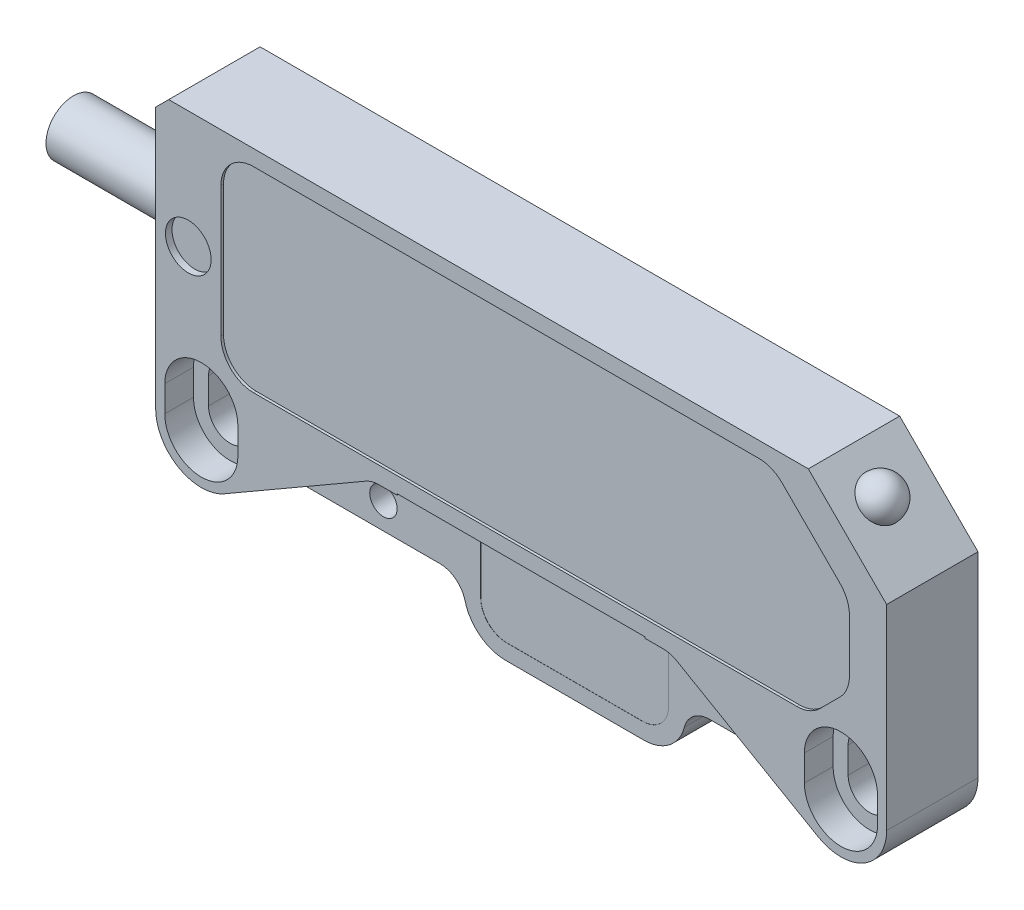
from build123d import *

# Parameters (mm, degrees)
BOSS_EXTRUDE1_DEPTH  = 7
CUT_EXTRUDE1_DEPTH   = 0.2
FILLET1_R            = 2.5
CHAMFER1_SIZE        = 6
CUT_EXTRUDE4_DEPTH   = 2.2
CUT_EXTRUDE5_DEPTH   = 59.720013624
SKETCH14_R           = 2.2
CUT_EXTRUDE9_DEPTH   = 0.2
CUT_EXTRUDE10_DEPTH  = 4.11
CHAMFER3_SIZE        = 1
FILLET3_R            = 3.2
SKETCH29_R           = 1.05
CUT_EXTRUDE16_DEPTH  = 10
FILLET5_R            = 2
FILLET6_R            = 2
MIRROR2_COPY_1_DEPTH = 2.2
SKETCH31_R           = 1.75
CUT_EXTRUDE17_DEPTH  = 0.5
CUT_EXTRUDE19_START  = -4.1
CUT_EXTRUDE19_DEPTH  = 4.1
SKETCH33_R           = 2.1
BOSS_EXTRUDE2_DEPTH  = 10


with BuildPart() as part:
    # Sketch1 → Boss-Extrude1 (new body)
    with BuildSketch(Plane.XY):
        with BuildLine():
            Line((0, -4), (0, 17))
            Line((0, 17), (56, 17))
            Line((56, 17), (56, -4))
            ThreePointArc((56, -4), (54.974873734, -6.474873734), (52.5, -7.5))
            Line((52.5, -7.5), (36.5, -7.5))
            Line((36.5, -7.5), (36.5, -11.4))
            Line((36.5, -11.4), (19.5, -11.4))
            Line((19.5, -11.4), (19.5, -7.5))
            Line((19.5, -7.5), (3.5, -7.5))
            ThreePointArc((3.5, -7.5), (1.025126266, -6.474873734), (0, -4))
        make_face()
    extrude(amount=BOSS_EXTRUDE1_DEPTH)

    # Sketch2 → Cut-Extrude1 (cut)
    with BuildSketch(Plane.XY.offset(7)):
        Polygon((5, 15.8), (5, 0.8), (50.15, 0.8), (53.15, 3.8), (53.15, 9.9), (47.25, 15.8), align=None)
    extrude(amount=-CUT_EXTRUDE1_DEPTH, mode=Mode.SUBTRACT)

    # Fillet1
    fillet1_edges = [part.edges().sort_by_distance(p)[0] for p in [
        (47.25, 15.8, 6.9),
        (53.15, 9.9, 6.9),
        (53.15, 3.8, 6.9),
        (50.15, 0.8, 6.9),
        (5, 0.8, 6.9),
        (5, 15.8, 6.9),
    ]]
    fillet(fillet1_edges, radius=FILLET1_R)

    # Chamfer1
    chamfer1_edges = [part.edges().sort_by_distance(p)[0] for p in [
        (56, 17, 3.5),
    ]]
    chamfer(chamfer1_edges, length=CHAMFER1_SIZE)

    # Sketch6 → Cut-Extrude4 (cut)
    with BuildSketch(Plane.XY.offset(7)):
        with BuildLine():
            Line((49.7, -4), (49.7, -2))
            ThreePointArc((49.7, -2), (52.5, 0.8), (55.3, -2))
            Line((55.3, -2), (55.3, -4))
            ThreePointArc((55.3, -4), (52.5, -6.8), (49.7, -4))
        make_face()
    cut_extrude4 = extrude(amount=-CUT_EXTRUDE4_DEPTH, mode=Mode.SUBTRACT)

    # Sketch9 → Cut-Extrude5 (cut, through all)
    with BuildSketch(Plane.XY.offset(4.8)):
        with BuildLine():
            Line((54.15, -4), (54.15, -2))
            ThreePointArc((54.15, -2), (52.5, -0.35), (50.85, -2))
            Line((50.85, -2), (50.85, -4))
            ThreePointArc((50.85, -4), (52.5, -5.65), (54.15, -4))
        make_face()
    cut_extrude5 = extrude(amount=-CUT_EXTRUDE5_DEPTH, mode=Mode.SUBTRACT)

    # Mirror1: Cut-Extrude4 across plane
    add(cut_extrude4.mirror(Plane.XY.offset(3.5)), mode=Mode.SUBTRACT)

    # Sketch14 → Cut-Extrude9 (cut)
    with BuildSketch(Plane(origin=(0, 24, 0), x_dir=(0, -1, 0), z_dir=(1, 0, 0))):
        with Locations(Location((16, -3.5, 0), (0, 0, 90))):
            Circle(SKETCH14_R)
    extrude(amount=CUT_EXTRUDE9_DEPTH, mode=Mode.SUBTRACT)

    # Sketch19 → Cut-Extrude10 (cut)
    with BuildSketch(Plane.XY.offset(7)):
        with BuildLine():
            Line((20.8, -0.4), (35.2, -0.4))
            Line((35.2, -0.4), (35.2, -8.2))
            ThreePointArc((35.2, -8.2), (34.614213562, -9.614213562), (33.2, -10.2))
            Line((33.2, -10.2), (22.8, -10.2))
            ThreePointArc((22.8, -10.2), (21.385786438, -9.614213562), (20.8, -8.2))
            Line((20.8, -8.2), (20.8, -0.4))
        make_face()
    extrude(amount=-CUT_EXTRUDE10_DEPTH, mode=Mode.SUBTRACT)

    # Chamfer3
    chamfer3_edges = [part.edges().sort_by_distance(p)[0] for p in [
        (0, 17, 3.5),
    ]]
    chamfer(chamfer3_edges, length=CHAMFER3_SIZE)

    # Fillet3
    fillet3_edges = [part.edges().sort_by_distance(p)[0] for p in [
        (36.5, -11.4, 3.5),
        (19.5, -11.4, 3.5),
    ]]
    fillet(fillet3_edges, radius=FILLET3_R)

    # Sketch29 → Cut-Extrude16 (cut)
    with BuildSketch(Plane(origin=(0, 0, 0), x_dir=(-1, 0, 0), z_dir=(0, 0, -1))):
        with Locations((-42.65, -5.5)):
            Circle(SKETCH29_R)
        with Locations((-41, -2.7)):
            Circle(SKETCH29_R)
        with Locations((-13.35, -5.5)):
            Circle(SKETCH29_R)
        with Locations((-15, -2.7)):
            Circle(SKETCH29_R)
    extrude(amount=-CUT_EXTRUDE16_DEPTH, mode=Mode.SUBTRACT)

    # Fillet5
    # the kernel refuses this fillet: 2 mm, written as the material it adds along each edge
    with BuildSketch(Plane(origin=(19.5, -7.5, 0), x_dir=(0.06758731351152399, -0.9977133631721562, 0), z_dir=(0, 0, 1))) as fillet5_piece_1:
        with BuildLine():
            CenterArc((1.871412228, -1.965857277), FILLET5_R, 100.602090028, 75.522487814)
            Line((-0.124014498, -1.83068265), (-0.323557171, -1.817165187))
            Line((-0.323557171, -1.817165187), (-0.199542673, 0.013517463))
            Line((-0.199542673, 0.013517463), (0.013517463, 0.199542673))
            ThreePointArc((0.013517463, 0.199542673), (0.711916817, 0.152231553), (1.466640375, 0.196585728))
            Line((1.466640375, 0.196585728), (1.503437816, 0))
        make_face()
    extrude(amount=7)
    # the kernel refuses this fillet: 2 mm, written as the material it takes off along each edge

    # Fillet6
    # the kernel refuses this fillet: 2 mm, written as the material it adds along each edge
    with BuildSketch(Plane(origin=(36.5, -7.5, 0), x_dir=(-0.06758731351152392, -0.9977133631721562, 0), z_dir=(0, 0, 1))) as fillet6_piece_1:
        with BuildLine():
            CenterArc((1.871412228, 1.965857277), FILLET6_R, 183.875422158, 75.522487814)
            Line((-0.124014498, 1.83068265), (-0.323557171, 1.817165187))
            Line((-0.323557171, 1.817165187), (-0.199542673, -0.013517463))
            Line((-0.199542673, -0.013517463), (0.013517463, -0.199542673))
            ThreePointArc((0.013517463, -0.199542673), (0.711916817, -0.152231553), (1.466640375, -0.196585728))
            Line((1.466640375, -0.196585728), (1.503437816, 0))
        make_face()
    extrude(amount=7)
    # the kernel refuses this fillet: 2 mm, written as the material it takes off along each edge

    # Mirror2: Cut-Extrude4, Cut-Extrude5 across plane
    add(cut_extrude4.mirror(Plane.ZY.offset(-28)), mode=Mode.SUBTRACT)
    add(cut_extrude5.mirror(Plane.ZY.offset(-28)), mode=Mode.SUBTRACT)

    # Mirror2 copy 1 sketch → Mirror2 copy 1 (cut)
    with BuildSketch(Plane(origin=(56, 0, 0), x_dir=(-1, 0, 0), z_dir=(0, 0, -1))):
        with BuildLine():
            Line((49.7, -4), (49.7, -2))
            ThreePointArc((49.7, -2), (52.5, 0.8), (55.3, -2))
            Line((55.3, -2), (55.3, -4))
            ThreePointArc((55.3, -4), (52.5, -6.8), (49.7, -4))
        make_face()
    extrude(amount=-MIRROR2_COPY_1_DEPTH, mode=Mode.SUBTRACT)

    # Sketch31 → Cut-Extrude17 (cut)
    with BuildSketch(Plane.XY.offset(7)):
        with Locations((2.5, 8)):
            Circle(SKETCH31_R)
    extrude(amount=-CUT_EXTRUDE17_DEPTH, mode=Mode.SUBTRACT)

    # Sketch28 → Cut-Extrude19 (cut)
    with BuildSketch(Plane.XY.offset(7).offset(CUT_EXTRUDE19_START)):
        with BuildLine():
            Line((16.098076211, -0.767949192), (5.25, -7.031088913))
            ThreePointArc((5.25, -7.031088913), (4.405866658, -7.380740392), (3.5, -7.5))
            Line((3.5, -7.5), (16.682429586, -7.5))
            ThreePointArc((16.682429586, -7.5), (17.389536367, -7.792893219), (17.682429586, -8.5))
            Line((17.682429586, -8.5), (17.682429586, -14.577281055))
            Line((17.682429586, -14.577281055), (38.317570414, -14.577281055))
            Line((38.317570414, -14.577281055), (38.317570414, -8.5))
            ThreePointArc((38.317570414, -8.5), (38.610463633, -7.792893219), (39.317570414, -7.5))
            Line((39.317570414, -7.5), (52.5, -7.5))
            ThreePointArc((52.5, -7.5), (51.594133342, -7.380740392), (50.75, -7.031088913))
            Line((50.75, -7.031088913), (39.901923789, -0.767949192))
            ThreePointArc((39.901923789, -0.767949192), (39.419561879, -0.568148347), (38.901923789, -0.5))
            Line((38.901923789, -0.5), (37.5, -0.5))
            Line((37.5, -0.5), (37.5, -0.4))
            Line((37.5, -0.4), (18.5, -0.4))
            Line((18.5, -0.4), (18.5, -0.5))
            Line((18.5, -0.5), (17.098076211, -0.5))
            ThreePointArc((17.098076211, -0.5), (16.580438121, -0.568148347), (16.098076211, -0.767949192))
        make_face()
    extrude(amount=CUT_EXTRUDE19_DEPTH, mode=Mode.SUBTRACT)

    # Sketch32 → Revolve1 (revolve)
    with BuildSketch(Plane(origin=(0, 0, 3.8), x_dir=(-1, 0, 0), z_dir=(0, 0, -1))):
        with BuildLine():
            Line((-52.333452378, 14.666547622), (-53.464823228, 13.535176772))
            ThreePointArc((-53.464823228, 13.535176772), (-53.933452378, 14.666547622), (-53.464823228, 15.797918472))
            Line((-53.464823228, 15.797918472), (-52.333452378, 14.666547622))
        make_face()
    revolve(axis=Axis((52.333452378, 14.666547622, 3.8), (0.7071067811865478, 0.7071067811865472, 0)))

    # Sketch33 → Boss-Extrude2 (add)
    with BuildSketch(Plane.ZY.offset(-0.2)):
        with Locations(Location((3.5, 8, 0), (0, 0, 180))):
            Circle(SKETCH33_R)
    extrude(amount=BOSS_EXTRUDE2_DEPTH)


solid = part.part
